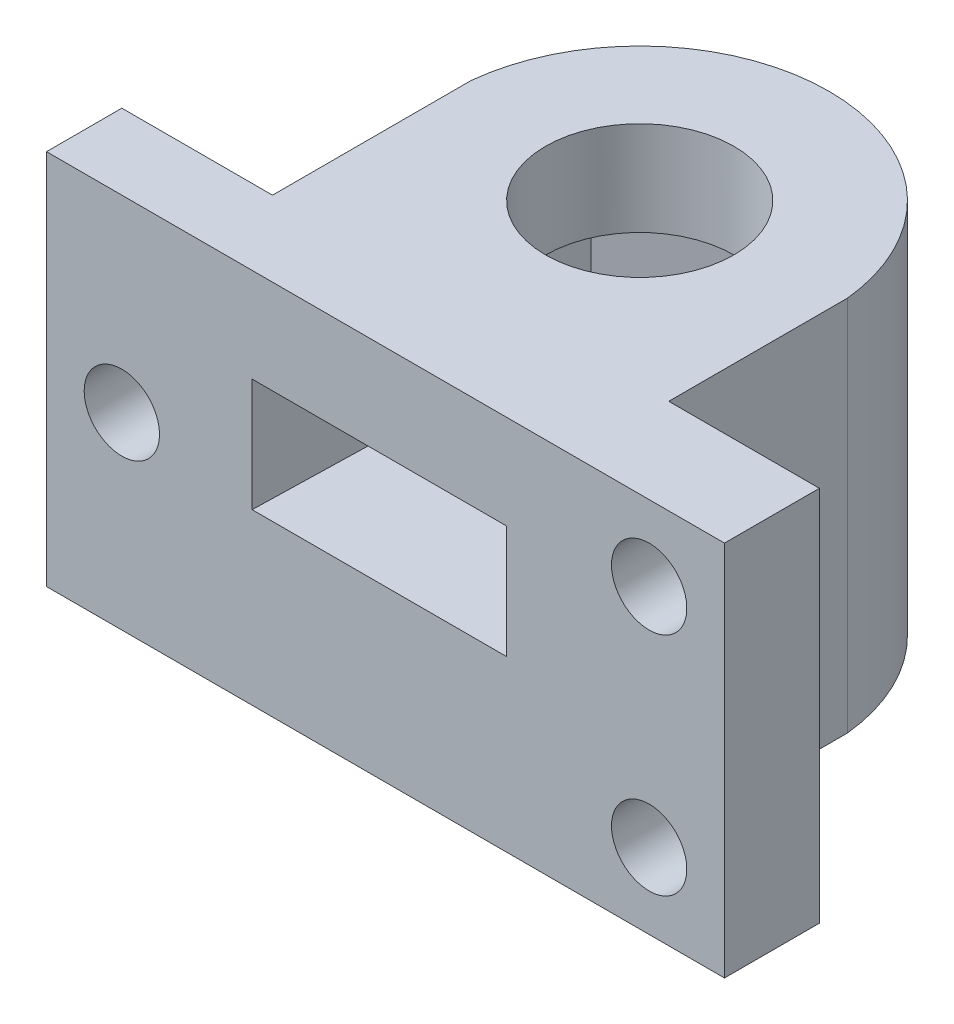
from build123d import *

# Parameters (mm, degrees)
SKETCH1_R           = 5
BOSS_EXTRUDE1_DEPTH = 20
CUT_EXTRUDE2_DEPTH  = 6
SKETCH9_R           = 2
CUT_EXTRUDE4_DEPTH  = 6
SKETCH10_W          = 13.49308662
SKETCH10_H          = 6.005400944
CUT_EXTRUDE5_DEPTH  = 10


with BuildPart() as part:
    # Sketch1 → Boss-Extrude1 (new body)
    with BuildSketch(Plane(origin=(0, 0, 0), x_dir=(1, 0, 0), z_dir=(0, 1, 0))):
        with BuildLine():
            Line((0, 0), (20, 0))
            Line((20, 0), (28, 0))
            Line((28, 0), (28, 5.039957232))
            Line((28, 5.039957232), (20, 5.039957232))
            Line((20, 5.039957232), (20, 14.539957232))
            ThreePointArc((20, 14.539957232), (10, 23.553930129), (0, 14.539957232))
            Line((0, 14.539957232), (0, 4))
            Line((0, 4), (-8, 4))
            Line((-8, 4), (-8, 0))
            Line((-8, 0), (0, 0))
        make_face()
        with Locations((10, 13.5)):
            Circle(SKETCH1_R, mode=Mode.SUBTRACT)
    extrude(amount=BOSS_EXTRUDE1_DEPTH)

    # Sketch4 → Cut-Extrude2 (cut)
    with BuildSketch(Plane(origin=(0, 15, 0), x_dir=(1, 0, 0), z_dir=(0, 1, 0))):
        Polygon((9.805510867, 5.708198284), (16.65065366, 9.435666612), (16.845142794, 17.227468328), (10.194489133, 21.291801716), (3.34934634, 17.564333388), (3.154857206, 9.772531672), align=None)
    extrude(amount=-CUT_EXTRUDE2_DEPTH, mode=Mode.SUBTRACT)

    # Sketch9 → Cut-Extrude4 (cut)
    with BuildSketch(Plane(origin=(0, 0, -5.039957232), x_dir=(-1, 0, 0), z_dir=(0, 0, -1))):
        with Locations((-24, 4)):
            Circle(SKETCH9_R)
        with Locations((-24, 16)):
            Circle(SKETCH9_R)
        with Locations((4, 10)):
            Circle(SKETCH9_R)
    extrude(amount=-CUT_EXTRUDE4_DEPTH, mode=Mode.SUBTRACT)

    # Sketch10 → Cut-Extrude5 (cut)
    with BuildSketch(Plane(origin=(0.245742109, 0, -9.845145337), x_dir=(-0.9996886262308401, 0, -0.024952967452705616), z_dir=(0.024952967452705616, 0, -0.9996886262308401))):
        with Locations((-9.663877352, 11.998541172)):
            Rectangle(SKETCH10_W, SKETCH10_H)
    extrude(amount=-CUT_EXTRUDE5_DEPTH, mode=Mode.SUBTRACT)


solid = part.part
